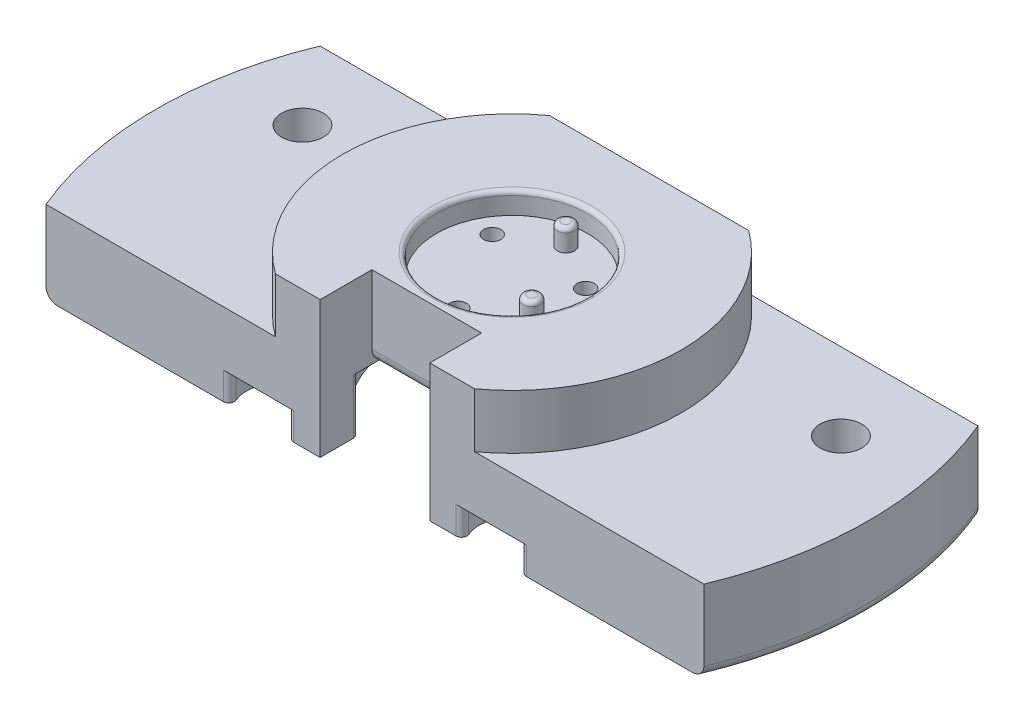
from build123d import *
from build123d.topology import SkipClean

# Parameters (mm, degrees)
SKETCH30_OUTSIDE_W       = 118.128
SKETCH30_OUTSIDE_H       = 118.128
SKETCH30_OUTSIDE_W_2     = 82.55
SKETCH30_OUTSIDE_H_2     = 50.8
CUT_EXTRUDE21_DEPTH      = 87.252543441
SHELL1_START             = 12.7
SHELL1_DEPTH             = 50.8
SHELL1_START_2           = 6.35
SHELL1_2_OUTLINE_R       = 3.7465
SHELL1_2_DEPTH           = 6.35
SHELL1_START_3           = -50.8
SHELL1_3_OUTLINE_R       = 3.7465
SHELL1_3_DEPTH           = 57.15
BOSS_EXTRUDE1_REACH      = 132.02
CUT_EXTRUDE12_DEPTH      = 80.881384721
CUT_EXTRUDE12_DEPTH_BACK = 80.881384721
SKETCH19_R               = 3.175
CUT_EXTRUDE13_DEPTH      = 4.7625
CUT_EXTRUDE13_DEPTH_BACK = 4.7625
SKETCH21_R               = 28.2575
SKETCH22_R               = 17.78
CUT_EXTRUDE15_DEPTH      = 5.08
CUT_EXTRUDE16_DEPTH      = 4.7625
CUT_EXTRUDE16_DEPTH_BACK = 4.7625
SKETCH23_R               = 13.97
CUT_EXTRUDE17_DEPTH      = 86.016516856
CUT_EXTRUDE17_DEPTH_BACK = 86.016516856
SKETCH24_R               = 3.7465
SKETCH25_R               = 3.7465
BOSS_EXTRUDE2_DEPTH      = 66.04
CUT_EXTRUDE22_DEPTH      = 135.028630399
CUT_EXTRUDE23_DEPTH      = 91.306288007
CUT_EXTRUDE23_DEPTH_BACK = 91.306288007
SKETCH32_W               = 95.286677043
SKETCH32_H               = 50.8
SKETCH37_R               = 0.889
CUT_EXTRUDE27_DEPTH      = 12.7
SKETCH39_R               = 3.1242
BOSS_EXTRUDE3_DEPTH      = 2.54
FILLET1_R                = 0.635
SKETCH40_R               = 1.905
CUT_EXTRUDE28_DEPTH      = 6.35
SKETCH41_R               = 11.303
CUT_EXTRUDE29_DEPTH      = 6.35
CUT_EXTRUDE31_DEPTH      = 57.15
SKETCH44_R               = 19.6215
CUT_EXTRUDE32_DEPTH      = 50.8
SKETCH45_R               = 13.589
SKETCH45_R_2             = 5.969
CUT_EXTRUDE33_DEPTH      = 2.2225
SKETCH48_R               = 13.2715
CUT_EXTRUDE35_DEPTH      = 86.016516938
SKETCH49_OUTSIDE_W       = 109.036
SKETCH49_OUTSIDE_H       = 70.936
SKETCH49_OUTSIDE_W_2     = 101.6
SKETCH49_OUTSIDE_H_2     = 31.75
CUT_EXTRUDE36_DEPTH      = 91.306288007
SKETCH50_R               = 3.81
CUT_EXTRUDE37_DEPTH      = 3.175
FILLET2_R                = 0.635
FILLET3_R                = 1.27
CUT_EXTRUDE38_DEPTH      = 6.35
CUT_EXTRUDE38_DEPTH_BACK = 6.35
SKETCH51_W               = 6
SKETCH51_H               = 9.525
FILLET4_R                = 0.635
CUT_EXTRUDE39_REACH      = 82.007
SKETCH52_W               = 12.7
SKETCH52_H               = 6
BOSS_EXTRUDE6_START      = -3.81
SKETCH59_R               = 3.7465
BOSS_EXTRUDE6_DEPTH      = 3.81
BOSS_EXTRUDE4_REACH      = 47.107
SKETCH54_W               = 13.335
SKETCH54_H               = 19.892835282
SKETCH62_R               = 1.905
BOSS_EXTRUDE7_DEPTH      = 3.175
SKETCH63_R               = 2.413
CUT_EXTRUDE45_DEPTH      = 6.35
BOSS_EXTRUDE9_DEPTH      = 3.14
FILLET7_R                = 1.5
SKETCH70_R               = 8.75
CUT_EXTRUDE46_DEPTH      = 2.5
SKETCH71_R               = 1
BOSS_EXTRUDE10_DEPTH     = 2.5
SKETCH72_R               = 1
CUT_EXTRUDE47_DEPTH      = 47.987398964
FILLET8_R                = 0.5


# Read off the part's stored shape, not the designer's step: Shell1
with BuildPart() as part:
    # Sketch1 → Revolve1 (revolve)
    with BuildSketch(Plane.XY, mode=Mode.PRIVATE) as revolve1_sk:
        Polygon((0, -57.15), (0, 63.5), (41.275, 63.5), (41.275, 0), (13.2715, 0), (13.2715, 6.35), (10.0965, 6.35), (10.0965, -57.15), align=None)
    revolve(revolve1_sk.sketch.rotate(Axis((0, 52.843565077, 0), (0, -1, 0)), 90), axis=Axis((0, 52.843565077, 0), (0, -1, 0)))

    # Sketch30 outside → Cut-Extrude21 (cut, through all)
    with BuildSketch(Plane.XZ):
        Rectangle(SKETCH30_OUTSIDE_W, SKETCH30_OUTSIDE_H)
        Rectangle(SKETCH30_OUTSIDE_W_2, SKETCH30_OUTSIDE_H_2, mode=Mode.SUBTRACT)
    extrude(amount=-CUT_EXTRUDE21_DEPTH, mode=Mode.SUBTRACT)

    # Shell1 outline → Shell1 (cut)
    with BuildSketch(Plane(origin=(0, 0, 0), x_dir=(1, 0, 0), z_dir=(0, 1, 0)).offset(SHELL1_START)):
        with BuildLine():
            ThreePointArc((-29.272053652, 19.05), (-34.925, 0), (-29.272053652, -19.05))
            Line((-29.272053652, -19.05), (29.272053652, -19.05))
            ThreePointArc((29.272053652, -19.05), (34.925, 0), (29.272053652, 19.05))
            Line((29.272053652, 19.05), (-29.272053652, 19.05))
        make_face()
    extrude(amount=SHELL1_DEPTH, mode=Mode.SUBTRACT)

    # Shell1 2 outline → Shell1 2 (cut)
    with BuildSketch(Plane(origin=(0, 0, 0), x_dir=(1, 0, 0), z_dir=(0, 1, 0)).offset(SHELL1_START_2)):
        with BuildLine():
            ThreePointArc((-4.701144781, -19.05), (-19.6215, 0), (-4.701144781, 19.05))
            Line((-4.701144781, 19.05), (-29.272053652, 19.05))
            ThreePointArc((-29.272053652, 19.05), (-34.925, 0), (-29.272053652, -19.05))
            Line((-29.272053652, -19.05), (-4.701144781, -19.05))
        make_face()
        with BuildLine():
            Line((29.272053652, 19.05), (4.701144781, 19.05))
            ThreePointArc((4.701144781, 19.05), (19.6215, 0), (4.701144781, -19.05))
            Line((4.701144781, -19.05), (29.272053652, -19.05))
            ThreePointArc((29.272053652, -19.05), (34.925, 0), (29.272053652, 19.05))
        make_face()
        Circle(SHELL1_2_OUTLINE_R)
    extrude(amount=SHELL1_2_DEPTH, mode=Mode.SUBTRACT)

    # Shell1 3 outline → Shell1 3 (cut)
    with BuildSketch(Plane(origin=(0, 0, 0), x_dir=(1, 0, 0), z_dir=(0, 1, 0)).offset(SHELL1_START_3)):
        Circle(SHELL1_3_OUTLINE_R)
    extrude(amount=SHELL1_3_DEPTH, mode=Mode.SUBTRACT)

    # Sketch18 → Boss-Extrude1 (add, up to next)
    with BuildSketch(Plane(origin=(0, 63.5, 0), x_dir=(1, 0, 0), z_dir=(0, 1, 0)), mode=Mode.PRIVATE) as boss_extrude1_sk1:
        with BuildLine():
            Line((-31.75, 14.549677831), (-31.75, -14.549677831))
            ThreePointArc((-31.75, -14.549677831), (-34.925, 0), (-31.75, 14.549677831))
        make_face()
    boss_extrude1_tool1 = extrude(boss_extrude1_sk1.sketch, amount=-BOSS_EXTRUDE1_REACH, mode=Mode.PRIVATE) - part.part
    # Sketch18 → Boss-Extrude1 (add, up to next)
    with BuildSketch(Plane(origin=(0, 63.5, 0), x_dir=(1, 0, 0), z_dir=(0, 1, 0)), mode=Mode.PRIVATE) as boss_extrude1_sk2:
        with BuildLine():
            Line((31.75, 14.549677831), (31.75, -14.549677831))
            ThreePointArc((31.75, -14.549677831), (34.925, 0), (31.75, 14.549677831))
        make_face()
    boss_extrude1_tool2 = extrude(boss_extrude1_sk2.sketch, amount=-BOSS_EXTRUDE1_REACH, mode=Mode.PRIVATE) - part.part
    add(boss_extrude1_tool1.solids().sort_by_distance((-33.025082, 63.5, 0))[0])
    add(boss_extrude1_tool2.solids().sort_by_distance((33.025082, 63.5, 0))[0])

    # Sketch19 → Cut-Extrude12 (cut, two sides: drawn at the far end of the back side and taken through both)
    with BuildSketch(Plane(origin=(0, 0, 0), x_dir=(0, 0, -1), z_dir=(1, 0, 0)).offset(-CUT_EXTRUDE12_DEPTH_BACK)):
        with Locations((-9.634664718, 31.75)):
            Circle(SKETCH19_R)
    extrude(amount=CUT_EXTRUDE12_DEPTH + CUT_EXTRUDE12_DEPTH_BACK, mode=Mode.SUBTRACT)

    # Sketch21 → Cut-Extrude13 (cut, two sides: drawn at the far end of the back side and taken through both)
    with BuildSketch(Plane(origin=(26.9875, 0, 0), x_dir=(0, 0, -1), z_dir=(1, 0, 0)).offset(-CUT_EXTRUDE13_DEPTH_BACK)):
        with Locations((-9.634664718, 31.75)):
            Circle(SKETCH21_R)
    extrude(amount=CUT_EXTRUDE13_DEPTH + CUT_EXTRUDE13_DEPTH_BACK, mode=Mode.SUBTRACT)

    # Sketch22 → Cut-Extrude15 (cut, symmetric)
    with BuildSketch(Plane(origin=(23.495, 0, 0), x_dir=(0, 0, -1), z_dir=(1, 0, 0))):
        with Locations((-9.634664718, 31.75)):
            Circle(SKETCH22_R)
    cut_extrude15 = extrude(amount=CUT_EXTRUDE15_DEPTH, both=True, mode=Mode.SUBTRACT)

    # Mirror1: Cut-Extrude15 across plane
    add(cut_extrude15.mirror(Plane(origin=(0, 0, 0), x_dir=(0, 0, 1), z_dir=(1, 0, 0))), mode=Mode.SUBTRACT)

    # Sketch23 → Cut-Extrude16 (cut, two sides: drawn at the far end of the back side and taken through both)
    with BuildSketch(Plane.ZY.offset(16.8275).offset(-CUT_EXTRUDE16_DEPTH_BACK)):
        with Locations((9.634664718, 31.75)):
            Circle(SKETCH23_R)
    extrude(amount=CUT_EXTRUDE16_DEPTH + CUT_EXTRUDE16_DEPTH_BACK, mode=Mode.SUBTRACT)

    # Sketch24 → Cut-Extrude17 (cut, two sides: drawn at the far end of the back side and taken through both)
    with SkipClean():  # the faces are left unmerged after this step: merging them gives an invalid solid
        with BuildSketch(Plane(origin=(0, 12.7, 0), x_dir=(1, 0, 0), z_dir=(0, 1, 0)).offset(-CUT_EXTRUDE17_DEPTH_BACK)):
            with Locations(Location((0, 0, 0), (0, 0, 270))):
                Circle(SKETCH24_R)
        extrude(amount=CUT_EXTRUDE17_DEPTH + CUT_EXTRUDE17_DEPTH_BACK, mode=Mode.SUBTRACT)

    # Sketch25 → Boss-Extrude2 (add)
    with BuildSketch(Plane.XZ.offset(57.15)):
        with Locations(Location((0, 0, 0), (0, 0, 270))):
            Circle(SKETCH25_R)
    extrude(amount=-BOSS_EXTRUDE2_DEPTH)

    # Sketch26 → Revolve2 (revolve)
    with BuildSketch(Plane.XY, mode=Mode.PRIVATE) as revolve2_sk:
        with BuildLine():
            Line((-6.4135, 76.2), (-12.7, 76.2))
            ThreePointArc((-12.7, 76.2), (-26.638973174, 71.456629283), (-41.275, 69.85))
            Line((-41.275, 69.85), (-41.275, 63.5))
            Line((-41.275, 63.5), (-6.4135, 63.5))
            Line((-6.4135, 63.5), (-6.4135, 76.2))
        make_face()
    revolve(revolve2_sk.sketch.rotate(Axis((0, 63.5, 0), (0, -1, 0)), 270), axis=Axis((0, 63.5, 0), (0, -1, 0)))

    # Sketch31 → Cut-Extrude22 (cut, through all)
    with BuildSketch(Plane.XZ.offset(-63.5)):
        with BuildLine():
            Line((32.534068682, -25.4), (-32.534068682, -25.4))
            ThreePointArc((-32.534068682, -25.4), (0, -41.275), (32.534068682, -25.4))
        make_face()
        with BuildLine():
            Line((-32.534068682, 25.4), (32.534068682, 25.4))
            ThreePointArc((32.534068682, 25.4), (0, 41.275), (-32.534068682, 25.4))
        make_face()
    extrude(amount=-CUT_EXTRUDE22_DEPTH, mode=Mode.SUBTRACT)

    # Sketch32 → Cut-Extrude23 (cut, two sides: drawn at the far end of the back side and taken through both)
    with BuildSketch(Plane(origin=(0, 0, 0), x_dir=(1, 0, 0), z_dir=(0, 1, 0)).offset(-CUT_EXTRUDE23_DEPTH_BACK)):
        with Locations((2.980488965, 44.45)):
            Rectangle(SKETCH32_W, SKETCH32_H)
    extrude(amount=CUT_EXTRUDE23_DEPTH + CUT_EXTRUDE23_DEPTH_BACK, mode=Mode.SUBTRACT)

    # Sketch37 → Cut-Extrude27 (cut)
    with BuildSketch(Plane(origin=(0, 76.2, 0), x_dir=(1, 0, 0), z_dir=(0, 1, 0))):
        with Locations(Location((-8.73125, 0, 0), (0, 0, 270))):
            Circle(SKETCH37_R)
        with Locations(Location((8.73125, 0, 0), (0, 0, 270))):
            Circle(SKETCH37_R)
    extrude(amount=-CUT_EXTRUDE27_DEPTH, mode=Mode.SUBTRACT)

    # Sketch39 → Boss-Extrude3 (add)
    with BuildSketch(Plane.XZ):
        with Locations(Location((-19.05, 0, 0), (0, 0, 270))):
            Circle(SKETCH39_R)
        with Locations(Location((19.05, 0, 0), (0, 0, 270))):
            Circle(SKETCH39_R)
    extrude(amount=BOSS_EXTRUDE3_DEPTH)

    # Fillet1
    fillet1_edges = [part.edges().sort_by_distance(p)[0] for p in [
        (-19.05, -2.54, 3.1242),
        (19.05, -2.54, 3.1242),
    ]]
    fillet(fillet1_edges, radius=FILLET1_R)

    # Sketch40 → Cut-Extrude28 (cut)
    with BuildSketch(Plane.XZ):
        with Locations(Location((31.185202787, -6.914797213, 0), (0, 0, 270))):
            Circle(SKETCH40_R)
        with Locations(Location((-31.185202787, -6.914797213, 0), (0, 0, 270))):
            Circle(SKETCH40_R)
    extrude(amount=-CUT_EXTRUDE28_DEPTH, mode=Mode.SUBTRACT)

    # Sketch41 → Cut-Extrude29 (cut)
    with BuildSketch(Plane(origin=(0, 76.2, 0), x_dir=(1, 0, 0), z_dir=(0, 1, 0))):
        with Locations(Location((0, 0, 0), (0, 0, 270))):
            Circle(SKETCH41_R)
    extrude(amount=-CUT_EXTRUDE29_DEPTH, mode=Mode.SUBTRACT)

    # Sketch43 → Cut-Extrude31 (cut)
    with BuildSketch(Plane(origin=(0, 6.35, 0), x_dir=(1, 0, 0), z_dir=(0, 1, 0))):
        with BuildLine():
            Line((-31.75, 19.05), (-31.75, -25.4))
            Line((-31.75, -25.4), (31.75, -25.4))
            Line((31.75, -25.4), (31.75, 19.05))
            Line((31.75, 19.05), (4.701144781, 19.05))
            ThreePointArc((4.701144781, 19.05), (0, -19.6215), (-4.701144781, 19.05))
            Line((-4.701144781, 19.05), (-31.75, 19.05))
        make_face()
    extrude(amount=CUT_EXTRUDE31_DEPTH, mode=Mode.SUBTRACT)

    # Sketch44 → Cut-Extrude32 (cut)
    with BuildSketch(Plane(origin=(0, 12.7, 0), x_dir=(1, 0, 0), z_dir=(0, 1, 0))):
        Circle(SKETCH44_R)
    extrude(amount=CUT_EXTRUDE32_DEPTH, mode=Mode.SUBTRACT)

    # Sketch45 → Cut-Extrude33 (cut)
    with BuildSketch(Plane(origin=(33.9725, 0, 0), x_dir=(0, 0, -1), z_dir=(1, 0, 0))):
        with Locations((-9.634664718, 31.75)):
            Circle(SKETCH45_R)
        with Locations((-9.634664718, 31.75)):
            Circle(SKETCH45_R_2, mode=Mode.SUBTRACT)
    extrude(amount=-CUT_EXTRUDE33_DEPTH, mode=Mode.SUBTRACT)

    # Sketch48 → Cut-Extrude35 (cut, through all)
    with BuildSketch(Plane.XZ.offset(-6.35)):
        with Locations(Location((0, 0, 0), (0, 0, 90))):
            Circle(SKETCH48_R)
    extrude(amount=CUT_EXTRUDE35_DEPTH, mode=Mode.SUBTRACT)

    # Sketch49 outside → Cut-Extrude36 (cut, through all)
    with BuildSketch(Plane.XZ):
        with Locations((0, 3.175)):
            Rectangle(SKETCH49_OUTSIDE_W, SKETCH49_OUTSIDE_H)
        Rectangle(SKETCH49_OUTSIDE_W_2, SKETCH49_OUTSIDE_H_2, mode=Mode.SUBTRACT)
    extrude(amount=-CUT_EXTRUDE36_DEPTH, mode=Mode.SUBTRACT)

    # Sketch50 → Cut-Extrude37 (cut)
    with BuildSketch(Plane.XZ):
        with Locations((-13.470384182, 13.470384182)):
            Circle(SKETCH50_R)
        with Locations((13.470384182, 13.470384182)):
            Circle(SKETCH50_R)
        with Locations((13.470384182, -13.470384182)):
            Circle(SKETCH50_R)
        with Locations((-13.470384182, -13.470384182)):
            Circle(SKETCH50_R)
    extrude(amount=-CUT_EXTRUDE37_DEPTH, mode=Mode.SUBTRACT)

    # Fillet2
    fillet2_edges = [part.edges().sort_by_distance(p)[0] for p in [
        (32.86125, 43.821418167, 15.875),
        (32.86125, 19.678581833, 15.875),
        (-10.515063088, 1.5875, 15.875),
        (-16.425705275, 1.5875, 15.875),
        (16.425705275, 1.5875, 15.875),
        (10.515063088, 1.5875, 15.875),
        (10.515063088, 1.5875, -15.875),
        (16.425705275, 1.5875, -15.875),
        (-16.425705275, 1.5875, -15.875),
        (-10.515063088, 1.5875, -15.875),
    ]]
    fillet(fillet2_edges, radius=FILLET2_R)

    # Fillet3
    fillet3_edges = [part.edges().sort_by_distance(p)[0] for p in [
        (41.275, 0, 0),
        (-41.275, 0, 0),
        (-41.275, 69.85, 0),
        (41.275, 69.85, 0),
    ]]
    fillet(fillet3_edges, radius=FILLET3_R)

    # Sketch51 → Cut-Extrude38 (cut, two sides: drawn at the far end of the back side and taken through both)
    with BuildSketch(Plane(origin=(0, 0, 0), x_dir=(0, 0, -1), z_dir=(1, 0, 0)).offset(-CUT_EXTRUDE38_DEPTH_BACK)):
        with Locations((-12.875, 4.7625)):
            Rectangle(SKETCH51_W, SKETCH51_H)
    extrude(amount=CUT_EXTRUDE38_DEPTH + CUT_EXTRUDE38_DEPTH_BACK, mode=Mode.SUBTRACT)

    # Fillet4
    fillet4_edges = [part.edges().sort_by_distance(p)[0] for p in [
        (-6.35, 3.175, 11.653763866),
        (6.35, 3.175, 11.653763866),
    ]]
    fillet(fillet4_edges, radius=FILLET4_R)

    # Sketch52 → Cut-Extrude39 (cut, up to next)
    with BuildSketch(Plane.XZ.offset(-9.525), mode=Mode.PRIVATE) as cut_extrude39_sk1:
        with Locations((0, 12.875)):
            Rectangle(SKETCH52_W, SKETCH52_H)
    cut_extrude39_tool1 = extrude(cut_extrude39_sk1.sketch, amount=-CUT_EXTRUDE39_REACH, mode=Mode.PRIVATE) & part.part
    add(cut_extrude39_tool1.solids().sort_by_distance((0, 9.525, 12.875))[0], mode=Mode.SUBTRACT)

    # Sketch59 → Boss-Extrude6 (add)
    with BuildSketch(Plane(origin=(0, 12.7, 0), x_dir=(1, 0, 0), z_dir=(0, 1, 0)).offset(BOSS_EXTRUDE6_START)):
        Circle(SKETCH59_R)
    extrude(amount=BOSS_EXTRUDE6_DEPTH)

    # Sketch53 → Cut-Revolve1 (revolve, cut)
    with BuildSketch(Plane.XY):
        Polygon((-19.6215, 6.35), (-19.6215, 12.7), (0, 12.7), (0, 88.9), (-45.0215, 88.9), (-45.0215, 6.35), align=None)
    revolve(axis=Axis((0, 100.373766563, 0), (0, -1, 0)), mode=Mode.SUBTRACT)

    # Sketch54 → Boss-Extrude4 (add, up to next)
    with BuildSketch(Plane(origin=(0, 6.35, 0), x_dir=(1, 0, 0), z_dir=(0, 1, 0)), mode=Mode.PRIVATE) as boss_extrude4_sk1:
        with Locations((27.6225, -5.928582359)):
            Rectangle(SKETCH54_W, SKETCH54_H)
    boss_extrude4_tool1 = extrude(boss_extrude4_sk1.sketch, amount=-BOSS_EXTRUDE4_REACH, mode=Mode.PRIVATE) - part.part
    add(boss_extrude4_tool1.solids().sort_by_distance((27.6225, 6.35, 5.928582))[0])

    # Sketch62 → Boss-Extrude7 (add)
    # profile 1 of 2: a face of its own
    with BuildSketch(Plane(origin=(0, 6.35, 0), x_dir=(1, 0, 0), z_dir=(0, 1, 0))):
        with BuildLine():
            Line((-38.1, -15.875), (-11.532026589, -15.875))
            ThreePointArc((-11.532026589, -15.875), (-19.6215, 0), (-11.532026589, 15.875))
            Line((-11.532026589, 15.875), (-38.1, 15.875))
            ThreePointArc((-38.1, 15.875), (-41.275, 0), (-38.1, -15.875))
        make_face()
        with Locations(Location((-31.185202787, 6.914797213, 0), (0, 0, 90))):
            Circle(SKETCH62_R, mode=Mode.SUBTRACT)
    # profile 2 of 2: a face of its own
    with BuildSketch(Plane(origin=(0, 6.35, 0), x_dir=(1, 0, 0), z_dir=(0, 1, 0))):
        with BuildLine():
            Line((11.532026589, -15.875), (38.1, -15.875))
            ThreePointArc((38.1, -15.875), (41.275, 0), (38.1, 15.875))
            Line((38.1, 15.875), (11.532026589, 15.875))
            ThreePointArc((11.532026589, 15.875), (19.6215, 0), (11.532026589, -15.875))
        make_face()
        with Locations(Location((31.185202787, 6.914797213, 0), (0, 0, 90))):
            Circle(SKETCH62_R, mode=Mode.SUBTRACT)
    extrude(amount=BOSS_EXTRUDE7_DEPTH)

    # Sketch63 → Cut-Extrude45 (cut)
    with BuildSketch(Plane(origin=(0, 9.525, 0), x_dir=(1, 0, 0), z_dir=(0, 1, 0))):
        with Locations(Location((31.185202787, 6.914797213, 0), (0, 0, 270))):
            Circle(SKETCH63_R)
        with Locations(Location((-31.185202787, 6.914797213, 0), (0, 0, 270))):
            Circle(SKETCH63_R)
    extrude(amount=-CUT_EXTRUDE45_DEPTH, mode=Mode.SUBTRACT)

    # Sketch69 → Boss-Extrude9 (add)
    with BuildSketch(Plane(origin=(0, 12.7, 0), x_dir=(1, 0, 0), z_dir=(0, 1, 0))):
        with BuildLine():
            Line((-6.35, -15.875), (-11.532026589, -15.875))
            ThreePointArc((-11.532026589, -15.875), (-19.6215, 0), (-11.532026589, 15.875))
            Line((-11.532026589, 15.875), (11.532026589, 15.875))
            ThreePointArc((11.532026589, 15.875), (19.6215, 0), (11.532026589, -15.875))
            Line((11.532026589, -15.875), (6.35, -15.875))
            Line((6.35, -15.875), (6.35, -9.875))
            Line((6.35, -9.875), (-6.35, -9.875))
            Line((-6.35, -9.875), (-6.35, -15.875))
        make_face()
    extrude(amount=BOSS_EXTRUDE9_DEPTH)

    # Fillet7
    fillet7_edges = [part.edges().sort_by_distance(p)[0] for p in [
        (0, 6.35, 9.875),
    ]]
    fillet(fillet7_edges, radius=FILLET7_R)

    # Sketch70 → Cut-Extrude46 (cut)
    with BuildSketch(Plane(origin=(0, 15.84, 0), x_dir=(1, 0, 0), z_dir=(0, 1, 0))):
        with Locations(Location((0, 0, 0), (0, 0, 270))):
            Circle(SKETCH70_R)
    extrude(amount=-CUT_EXTRUDE46_DEPTH, mode=Mode.SUBTRACT)

    # Sketch71 → Boss-Extrude10 (add)
    with BuildSketch(Plane(origin=(0, 13.34, 0), x_dir=(1, 0, 0), z_dir=(0, 1, 0))):
        with Locations(Location((0, 6.25, 0), (0, 0, 270))):
            Circle(SKETCH71_R)
        with Locations(Location((5.412658774, -3.125, 0), (0, 0, 270))):
            Circle(SKETCH71_R)
    extrude(amount=BOSS_EXTRUDE10_DEPTH)

    # Sketch72 → Cut-Extrude47 (cut, through all)
    with BuildSketch(Plane(origin=(0, 13.34, 0), x_dir=(1, 0, 0), z_dir=(0, 1, 0))):
        with Locations(Location((0, -6.25, 0), (0, 0, 270))):
            Circle(SKETCH72_R)
        with Locations(Location((-5.412658774, 3.125, 0), (0, 0, 270))):
            Circle(SKETCH72_R)
        with Locations(Location((5.412658774, 3.125, 0), (0, 0, 270))):
            Circle(SKETCH72_R)
    extrude(amount=-CUT_EXTRUDE47_DEPTH, mode=Mode.SUBTRACT)

    # Fillet8
    fillet8_edges = [part.edges().sort_by_distance(p)[0] for p in [
        (0, 15.84, -8.75),
        (0, 15.84, -7.25),
        (5.412658774, 15.84, 2.125),
    ]]
    fillet(fillet8_edges, radius=FILLET8_R)


solid = part.part
